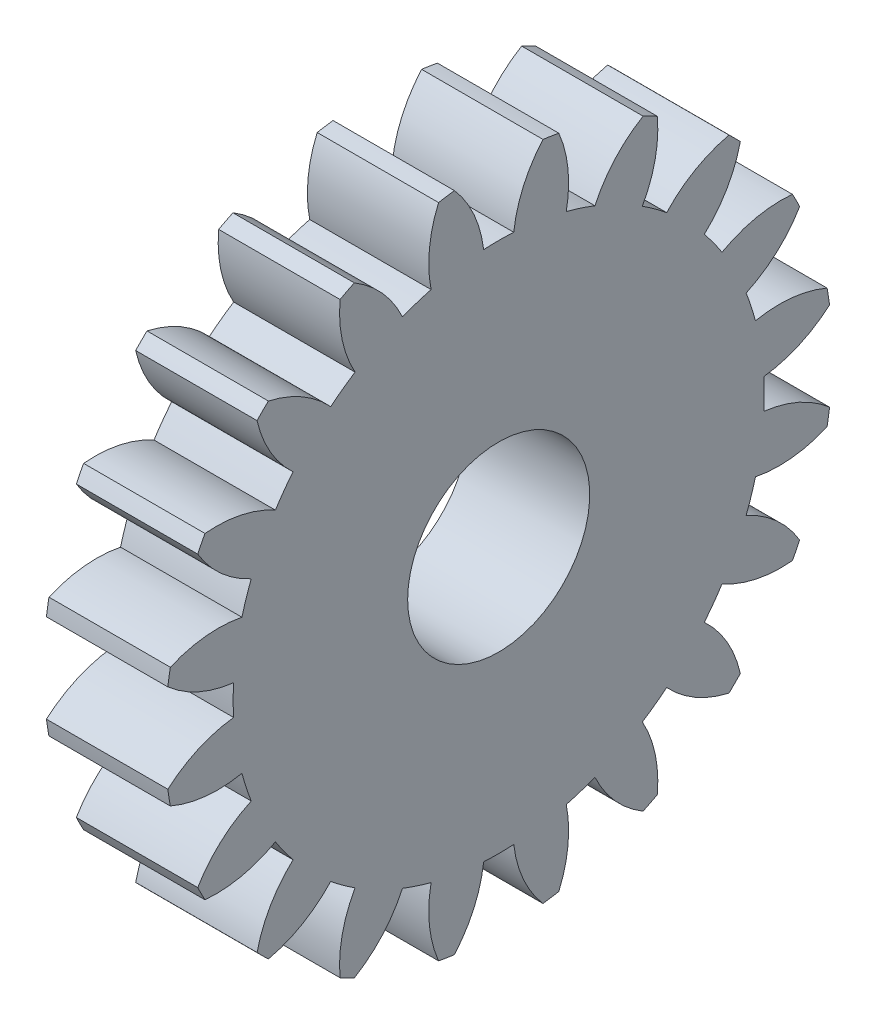
from build123d import *

# Parameters (mm, degrees)
BASPROSKE_W     = 6
BASPROSKE_H     = 16.5
TOOTHCUT_DEPTH  = 25.093567606
TEETHCUTS_COUNT = 20
TEETHCUTS_ANGLE = 342
BORSKE_R        = 4.5
BORE_DEPTH      = 50.0000508


with BuildPart() as part:
    # BasProSke → Base-Revolve (revolve)
    with BuildSketch(Plane(origin=(0, 0, 0), x_dir=(1, 0, 0), z_dir=(0, 1, 0))):
        with Locations((3, 8.25)):
            Rectangle(BASPROSKE_W, BASPROSKE_H)
    revolve(axis=Axis((-10, 0, 0), (1, 0, 0)))

    # TooCutSke → ToothCut (cut, through all)
    with BuildSketch(Plane(origin=(0, 0, 0), x_dir=(0, 0, -1), z_dir=(1, 0, 0))):
        with BuildLine():
            ThreePointArc((0.74381438, 13.102904875), (0, 13.124), (-0.74381438, 13.102904875))
            ThreePointArc((-0.74381438, 13.102904875), (-1.226473103, 14.852072512), (-2.209965745, 16.376962373))
            ThreePointArc((-2.209965745, 16.376962373), (0, 16.5254), (2.209965745, 16.376962373))
            ThreePointArc((2.209965745, 16.376962373), (1.226473103, 14.852072512), (0.74381438, 13.102904875))
        make_face()
    toothcut = extrude(amount=TOOTHCUT_DEPTH, mode=Mode.SUBTRACT)

    # TeethCuts: ToothCut ×20 about axis
    teethcuts_axis = Axis((-10, 0, 0), (1, 0, 0))
    for i in range(1, TEETHCUTS_COUNT):
        add(toothcut.rotate(teethcuts_axis, i * TEETHCUTS_ANGLE / (TEETHCUTS_COUNT - 1)), mode=Mode.SUBTRACT)

    # BorSke → Bore (cut, symmetric)
    with BuildSketch(Plane(origin=(0, 0, 0), x_dir=(0, 0, -1), z_dir=(1, 0, 0))):
        Circle(BORSKE_R)
    extrude(amount=BORE_DEPTH, both=True, mode=Mode.SUBTRACT)


solid = part.part
